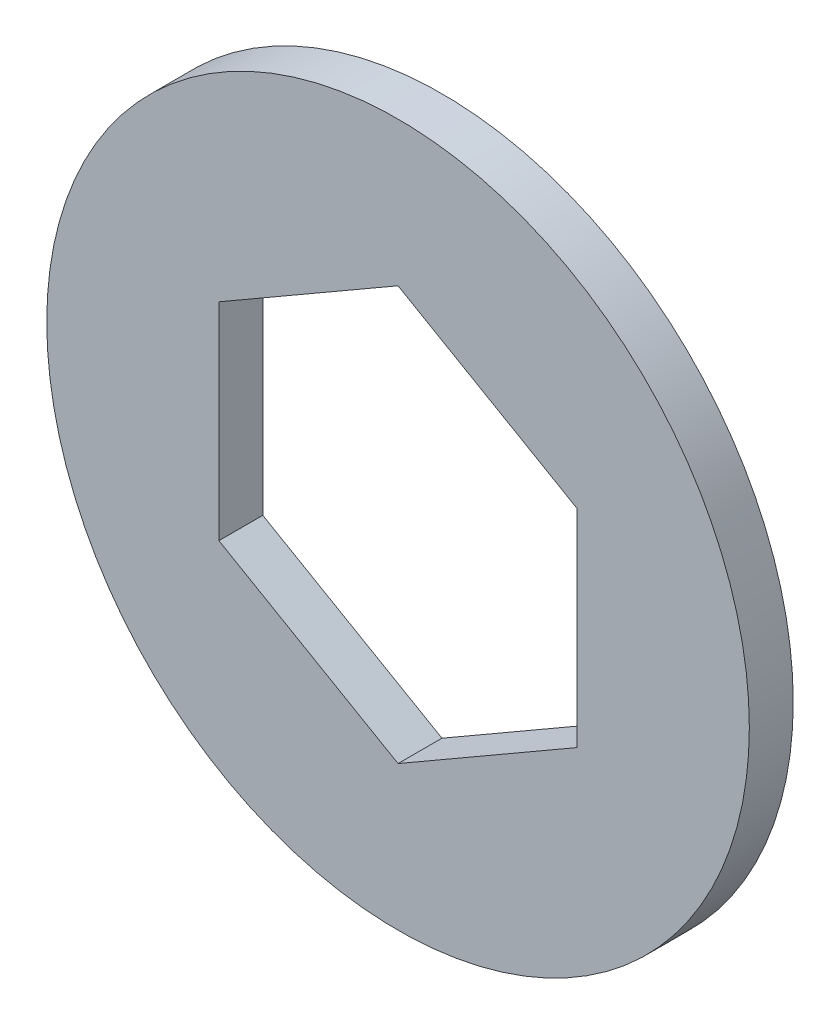
from build123d import *

# Parameters (mm, degrees)
SKETCH1_R           = 12.7
BOSS_EXTRUDE1_DEPTH = 0.79375


with BuildPart() as part:
    # Sketch1 → Boss-Extrude1 (new, symmetric)
    with BuildSketch(Plane.XY):
        Circle(SKETCH1_R)
        Polygon((0, 7.478995387), (-6.477, 3.739497694), (-6.477, -3.739497694), (0, -7.478995387), (6.477, -3.739497694), (6.477, 3.739497694), align=None, mode=Mode.SUBTRACT)
    extrude(amount=BOSS_EXTRUDE1_DEPTH, both=True)


solid = part.part
